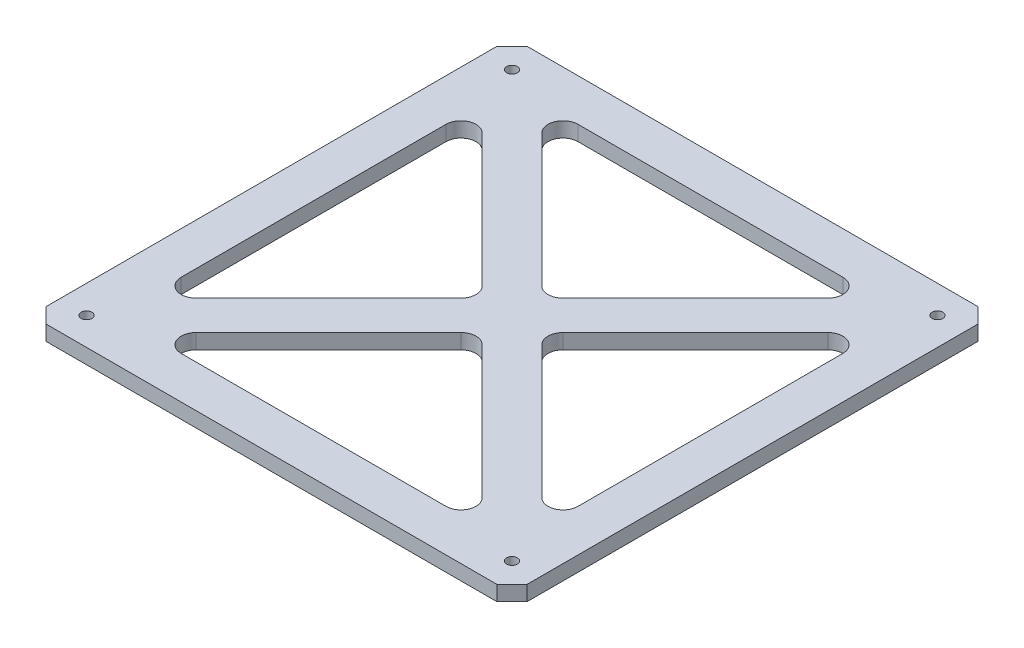
from build123d import *

# Parameters (mm, degrees)
BOSS_EXTRUDE1_DEPTH = 6.35
CUT_EXTRUDE1_DEPTH  = 288.438345563
SKETCH3_R           = 2.286
CUT_EXTRUDE2_DEPTH  = 288.438345563


with BuildPart() as part:
    # Sketch1 → Boss-Extrude1 (new body)
    with BuildSketch(Plane(origin=(0, 0, 0), x_dir=(1, 0, 0), z_dir=(0, 1, 0))):
        Polygon((0, 196.85), (6.35, 203.2), (196.85, 203.2), (203.2, 196.85), (203.2, 6.35), (196.85, 0), (6.35, 0), (0, 6.35), align=None)
    extrude(amount=BOSS_EXTRUDE1_DEPTH)

    # Sketch2 → Cut-Extrude1 (cut, through all)
    with BuildSketch(Plane(origin=(0, 6.35, 0), x_dir=(1, 0, 0), z_dir=(0, 1, 0))):
        with BuildLine():
            Line((45.682614691, 185.42), (157.517385309, 185.42))
            ThreePointArc((157.517385309, 185.42), (163.384020341, 181.500039796), (162.00751337, 174.579871939))
            Line((162.00751337, 174.579871939), (106.090128061, 118.66248663))
            ThreePointArc((106.090128061, 118.66248663), (101.6, 116.802614691), (97.109871939, 118.66248663))
            Line((97.109871939, 118.66248663), (41.19248663, 174.579871939))
            ThreePointArc((41.19248663, 174.579871939), (39.815979659, 181.500039796), (45.682614691, 185.42))
        make_face()
        with BuildLine():
            Line((17.78, 157.517385309), (17.78, 45.682614691))
            ThreePointArc((17.78, 45.682614691), (21.699960204, 39.815979659), (28.620128061, 41.19248663))
            Line((28.620128061, 41.19248663), (84.53751337, 97.109871939))
            ThreePointArc((84.53751337, 97.109871939), (86.397385309, 101.6), (84.53751337, 106.090128061))
            Line((84.53751337, 106.090128061), (28.620128061, 162.00751337))
            ThreePointArc((28.620128061, 162.00751337), (21.699960204, 163.384020341), (17.78, 157.517385309))
        make_face()
        with BuildLine():
            Line((45.682614691, 17.78), (157.517385309, 17.78))
            ThreePointArc((157.517385309, 17.78), (163.384020341, 21.699960204), (162.00751337, 28.620128061))
            Line((162.00751337, 28.620128061), (106.090128061, 84.53751337))
            ThreePointArc((106.090128061, 84.53751337), (101.6, 86.397385309), (97.109871939, 84.53751337))
            Line((97.109871939, 84.53751337), (41.19248663, 28.620128061))
            ThreePointArc((41.19248663, 28.620128061), (39.815979659, 21.699960204), (45.682614691, 17.78))
        make_face()
        with BuildLine():
            Line((185.42, 157.517385309), (185.42, 45.682614691))
            ThreePointArc((185.42, 45.682614691), (181.500039796, 39.815979659), (174.579871939, 41.19248663))
            Line((174.579871939, 41.19248663), (118.66248663, 97.109871939))
            ThreePointArc((118.66248663, 97.109871939), (116.802614691, 101.6), (118.66248663, 106.090128061))
            Line((118.66248663, 106.090128061), (174.579871939, 162.00751337))
            ThreePointArc((174.579871939, 162.00751337), (181.500039796, 163.384020341), (185.42, 157.517385309))
        make_face()
    extrude(amount=-CUT_EXTRUDE1_DEPTH, mode=Mode.SUBTRACT)

    # Sketch3 → Cut-Extrude2 (cut, through all)
    with BuildSketch(Plane(origin=(0, 6.35, 0), x_dir=(1, 0, 0), z_dir=(0, 1, 0))):
        with Locations((11.73734, 11.73734)):
            Circle(SKETCH3_R)
        with Locations((191.46266, 11.73734)):
            Circle(SKETCH3_R)
        with Locations((191.46266, 191.46266)):
            Circle(SKETCH3_R)
        with Locations((11.73734, 191.46266)):
            Circle(SKETCH3_R)
    extrude(amount=-CUT_EXTRUDE2_DEPTH, mode=Mode.SUBTRACT)


solid = part.part
